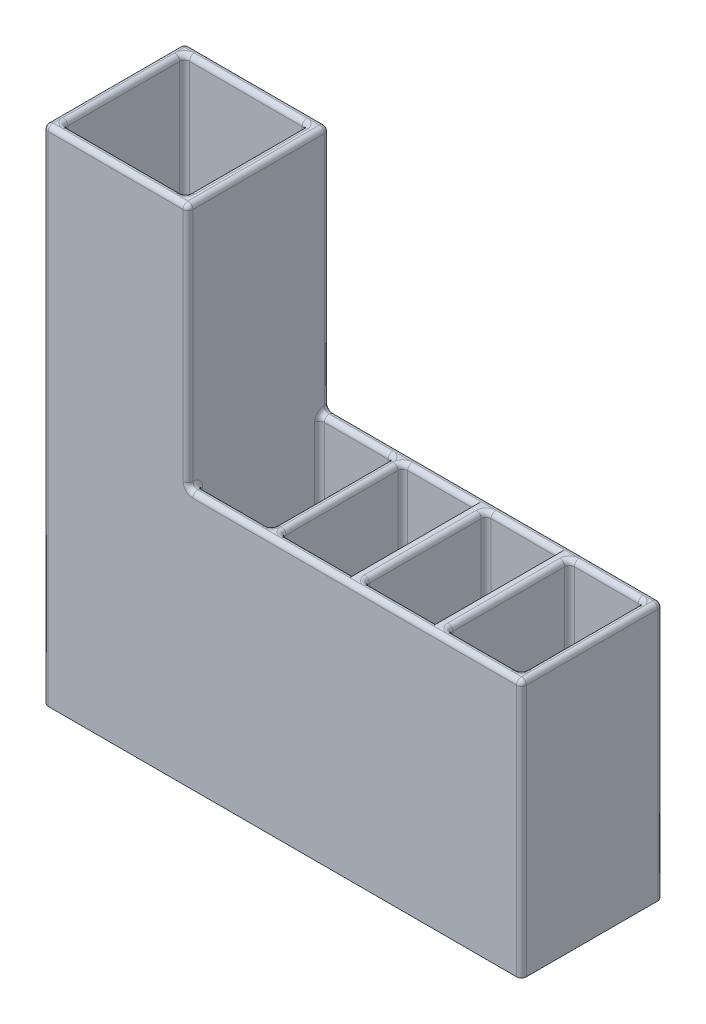
from build123d import *

# Parameters (mm, degrees)
SKETCH1_W                                  = 123.825
SKETCH1_H                                  = 36.576
SKETCH1_W_2                                = 31.75
SKETCH1_H_2                                = 31.496
SKETCH1_W_3                                = 83.82
BOSS_EXTRUDE1_DEPTH                        = 127
SKETCH2_W                                  = 123.825
SKETCH2_H                                  = 36.576
BOSS_EXTRUDE2_DEPTH                        = 3.175
SKETCH3_W                                  = 86.36
SKETCH3_H                                  = 36.576
CUT_EXTRUDE1_DEPTH                         = 63.5
SKETCH5_W                                  = 2.54
SKETCH5_H                                  = 31.496
BOSS_EXTRUDE4_DEPTH                        = 63.5
FILLET1_R                                  = 1.27
CSK_FOR_10_FLAT_HEAD_MACHINE_SCREW_2_COUNT = 2
CSK_FOR_10_FLAT_HEAD_MACHINE_SCREW_2_PITCH = 50.165
CSK_FOR_10_FLAT_HEAD_MACHINE_SCREW_3_COUNT = 2
CSK_FOR_10_FLAT_HEAD_MACHINE_SCREW_3_PITCH = 93.345


with BuildPart() as part:
    # Sketch1 → Boss-Extrude1 (new body)
    with BuildSketch(Plane(origin=(0, 0, 0), x_dir=(1, 0, 0), z_dir=(0, 1, 0))):
        Rectangle(SKETCH1_W, SKETCH1_H)
        with Locations((-43.4975, 0)):
            Rectangle(SKETCH1_W_2, SKETCH1_H_2, mode=Mode.SUBTRACT)
        with Locations((17.4625, 0)):
            Rectangle(SKETCH1_W_3, SKETCH1_H_2, mode=Mode.SUBTRACT)
    extrude(amount=BOSS_EXTRUDE1_DEPTH)

    # Sketch2 → Boss-Extrude2 (add)
    with BuildSketch(Plane.XZ):
        Rectangle(SKETCH2_W, SKETCH2_H)
    extrude(amount=BOSS_EXTRUDE2_DEPTH)

    # Sketch3 → Cut-Extrude1 (cut)
    with BuildSketch(Plane(origin=(0, 127, 0), x_dir=(1, 0, 0), z_dir=(0, 1, 0))):
        with Locations((18.7325, 0)):
            Rectangle(SKETCH3_W, SKETCH3_H)
    extrude(amount=-CUT_EXTRUDE1_DEPTH, mode=Mode.SUBTRACT)

    # Sketch5 → Boss-Extrude4 (add)
    with BuildSketch(Plane(origin=(0, 0, 0), x_dir=(1, 0, 0), z_dir=(0, 1, 0))):
        with Locations((-4.1275, 0)):
            Rectangle(SKETCH5_W, SKETCH5_H)
        with Locations((17.4625, 0)):
            Rectangle(SKETCH5_W, SKETCH5_H)
        with Locations((39.0525, 0)):
            Rectangle(SKETCH5_W, SKETCH5_H)
    extrude(amount=BOSS_EXTRUDE4_DEPTH)

    # Fillet1
    fillet1_edges = [part.edges().sort_by_distance(p)[0] for p in [
        (28.2575, 0, 15.748),
        (6.6675, 0, -15.748),
        (18.7325, 31.75, -15.748),
        (18.7325, 63.5, 0),
        (18.7325, 31.75, 15.748),
        (18.7325, 0, 0),
        (16.1925, 0, 0),
        (49.8475, 63.5, -15.748),
        (28.2575, 63.5, 15.748),
        (49.8475, 0, 15.748),
        (28.2575, 0, -15.748),
        (40.3225, 31.75, -15.748),
        (40.3225, 63.5, 0),
        (40.3225, 31.75, 15.748),
        (40.3225, 0, 0),
        (37.7825, 0, 0),
        (-61.9125, 127, 0),
        (-27.6225, 0, 0),
        (-27.6225, 63.5, 15.748),
        (-43.4975, 0, -15.748),
        (-27.6225, 63.5, -15.748),
        (-59.3725, 0, 0),
        (-59.3725, 63.5, -15.748),
        (-43.4975, 0, 15.748),
        (-59.3725, 63.5, 15.748),
        (-27.6225, 127, 0),
        (-43.18, 127, 18.288),
        (-43.4975, 127, -15.748),
        (-59.3725, 127, 0),
        (-43.4975, 127, 15.748),
        (-24.4475, 0, 0),
        (-14.9225, 0, 15.748),
        (59.3725, 0, 0),
        (49.8475, 0, -15.748),
        (-24.4475, 127, 0),
        (59.3725, 31.75, -15.748),
        (-24.4475, 31.75, -15.748),
        (-14.9225, 63.5, -15.748),
        (59.3725, 31.75, 15.748),
        (-24.4475, 31.75, 15.748),
        (61.9125, 30.1625, 18.288),
        (61.9125, 30.1625, -18.288),
        (-43.18, 127, -18.288),
        (59.3725, 63.5, 0),
        (49.8475, 63.5, 15.748),
        (-24.4475, 63.5, 17.018),
        (-24.4475, 95.25, 18.288),
        (18.7325, 63.5, -18.288),
        (-24.4475, 95.25, -18.288),
        (-24.4475, 63.5, -17.018),
        (18.7325, 63.5, 18.288),
        (61.9125, 63.5, 0),
        (-61.9125, 61.9125, 18.288),
        (-61.9125, 61.9125, -18.288),
        (-14.9225, 63.5, 15.748),
        (6.6675, 63.5, -15.748),
        (-14.9225, 0, -15.748),
        (6.6675, 0, 15.748),
        (-2.8575, 31.75, -15.748),
        (-2.8575, 63.5, 0),
        (-2.8575, 31.75, 15.748),
        (-2.8575, 0, 0),
        (-5.3975, 31.75, 15.748),
        (-5.3975, 63.5, 0),
        (-5.3975, 31.75, -15.748),
        (-5.3975, 0, 0),
        (28.2575, 63.5, -15.748),
        (6.6675, 63.5, 15.748),
    ]]
    fillet(fillet1_edges, radius=FILLET1_R - 0.0001)  # a hair under: the kernel refuses the full size

    # Sketch7 → CSK for #10 Flat Head Machine Screw (100)1 (revolve, cut)
    with BuildSketch(Plane(origin=(-43.4975, 0, 0), x_dir=(0, 0, 1), z_dir=(1, 0, 0))):
        Polygon((0, 0), (0, 3.175), (2.5527, 3.175), (2.5527, 1.960808018), (4.8895, 0), align=None)
    csk_for_10_flat_head_machine_screw_100 = revolve(axis=Axis((-43.4975, 6.35, 0), (0, -1, 0)), mode=Mode.SUBTRACT)

    # CSK for _10 Flat Head Machine Screw  2: CSK for #10 Flat Head Machine Screw (100)1 ×2
    with Locations(*[(i * CSK_FOR_10_FLAT_HEAD_MACHINE_SCREW_2_PITCH, 0, 0) for i in range(1, CSK_FOR_10_FLAT_HEAD_MACHINE_SCREW_2_COUNT)]):
        add(csk_for_10_flat_head_machine_screw_100, mode=Mode.SUBTRACT)

    # CSK for _10 Flat Head Machine Screw  3: CSK for #10 Flat Head Machine Screw (100)1 ×2
    with Locations(*[(i * CSK_FOR_10_FLAT_HEAD_MACHINE_SCREW_3_PITCH, 0, 0) for i in range(1, CSK_FOR_10_FLAT_HEAD_MACHINE_SCREW_3_COUNT)]):
        add(csk_for_10_flat_head_machine_screw_100, mode=Mode.SUBTRACT)


solid = part.part
